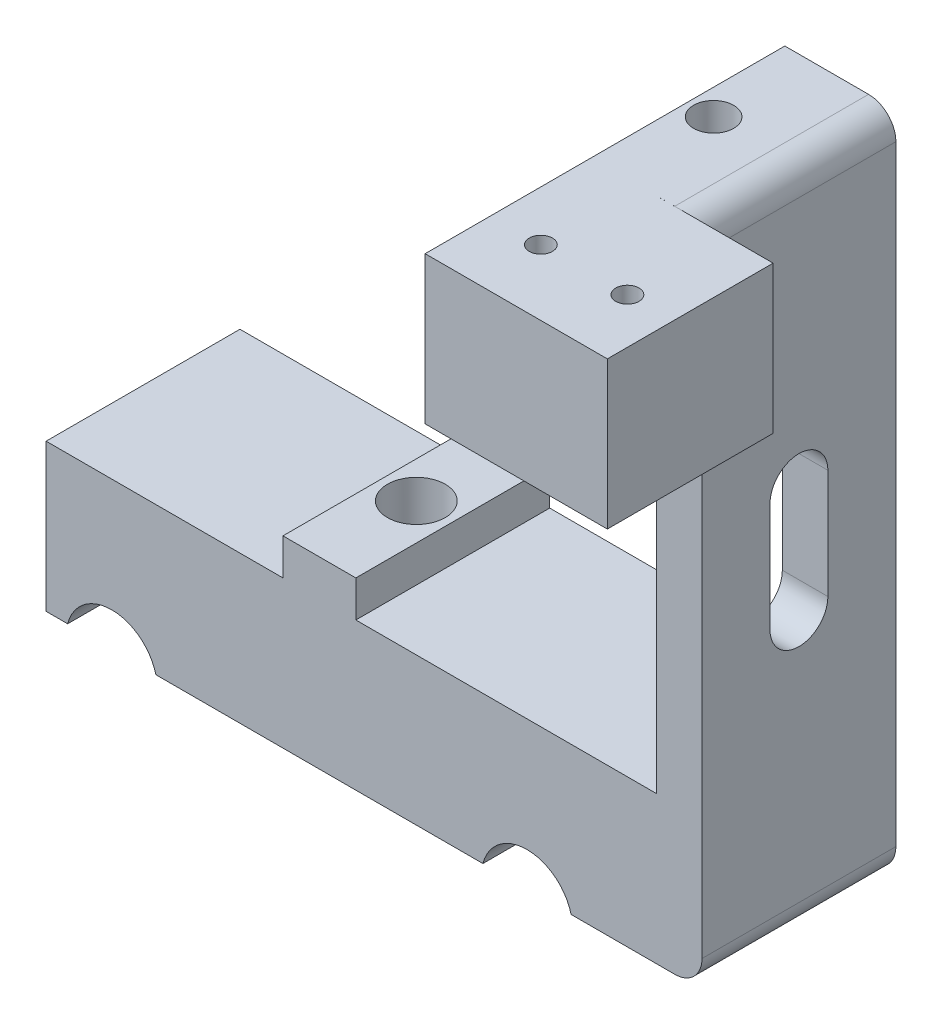
from build123d import *

# Parameters (mm, degrees)
BOSS_EXTRUDE1_DEPTH     = 10.8
BOSS_EXTRUDE2_DEPTH     = 10.64
CUT_EXTRUDE1_DEPTH      = 39.168054705
CUT_EXTRUDE1_DEPTH_BACK = 39.168054705
SKETCH5_R               = 5
FILLET1_R               = 1
SKETCH6_W               = 21.28
SKETCH6_H               = 16.18
BOSS_EXTRUDE3_DEPTH     = 12
SKETCH7_W               = 5
SKETCH7_H               = 21.281328743
BOSS_EXTRUDE4_DEPTH     = 56.83
SKETCH8_W               = 21.284331222
SKETCH8_H               = 16.18
BOSS_EXTRUDE5_DEPTH     = 7.19
FILLET3_R               = 3
SKETCH9_R               = 2.2
CUT_EXTRUDE2_DEPTH      = 85.918196519
SKETCH10_R              = 3.175
CUT_EXTRUDE3_DEPTH      = 85.918196519
SKETCH11_W              = 24.977296572
SKETCH11_H              = 9.721484234
CUT_EXTRUDE4_DEPTH      = 71.220021919
CUT_EXTRUDE5_DEPTH      = 90.46728118
SKETCH13_W              = 20
SKETCH13_H              = 16.18
BOSS_EXTRUDE6_DEPTH     = 18.2
SKETCH14_R              = 1.275
CUT_EXTRUDE6_DEPTH      = 93.969968226


with BuildPart() as part:
    # Sketch2 → Boss-Extrude1 (new body)
    with BuildSketch(Plane.XY):
        Polygon((10.1, 0), (10.1, 1.709943763), (6.25480432, 7), (-6.25480432, 7), (-10.1, 1.709943763), (-10.1, 0), align=None)
    extrude(amount=BOSS_EXTRUDE1_DEPTH)

    # Sketch4 → Boss-Extrude2 (add, symmetric)
    with BuildSketch(Plane.XY):
        Polygon((-4, 0), (-4, -4.8), (-30, -4.8), (-30, -20.98), (30, -20.98), (30, -4.8), (4, -4.8), (4, 0), align=None)
    extrude(amount=BOSS_EXTRUDE2_DEPTH, both=True)

    # Sketch5 → Cut-Extrude1 (cut, two sides: drawn at the far end of the back side and taken through both)
    with BuildSketch(Plane.XY.offset(-CUT_EXTRUDE1_DEPTH_BACK)):
        with Locations((-22.790976064, -22.227391232)):
            Circle(SKETCH5_R)
        with Locations((22.790976064, -22.227391232)):
            Circle(SKETCH5_R)
    extrude(amount=CUT_EXTRUDE1_DEPTH + CUT_EXTRUDE1_DEPTH_BACK, mode=Mode.SUBTRACT)

    # Fillet1
    fillet1_edges = [part.edges().sort_by_distance(p)[0] for p in [
        (-10.1, 0, 5.4),
        (-10.1, 1.709943763, 5.4),
        (-6.25480432, 7, 5.4),
        (6.25480432, 7, 5.4),
        (10.1, 0, 5.4),
        (10.1, 1.709943763, 5.4),
    ]]
    fillet(fillet1_edges, radius=FILLET1_R)

    # Sketch6 → Boss-Extrude3 (add)
    with BuildSketch(Plane(origin=(30, 0, 0), x_dir=(0, 0, -1), z_dir=(1, 0, 0))):
        with Locations((0, -12.89)):
            Rectangle(SKETCH6_W, SKETCH6_H)
    extrude(amount=BOSS_EXTRUDE3_DEPTH)

    # Sketch7 → Boss-Extrude4 (add)
    with BuildSketch(Plane(origin=(0, -4.8, 0), x_dir=(1, 0, 0), z_dir=(0, 1, 0))):
        with Locations((39.5, 0.000664372)):
            Rectangle(SKETCH7_W, SKETCH7_H)
    extrude(amount=BOSS_EXTRUDE4_DEPTH)

    # Sketch8 → Boss-Extrude5 (add)
    with BuildSketch(Plane.ZY.offset(-37)):
        with Locations((0.000836868, 43.94)):
            Rectangle(SKETCH8_W, SKETCH8_H)
    extrude(amount=BOSS_EXTRUDE5_DEPTH)

    # Fillet3
    fillet3_edges = [part.edges().sort_by_distance(p)[0] for p in [
        (42, 52.03, -0.000664372),
        (42, -20.98, 0),
    ]]
    fillet(fillet3_edges, radius=FILLET3_R)

    # Sketch9 → Cut-Extrude2 (cut, through all)
    with BuildSketch(Plane.XZ.offset(20.98)):
        with Locations((32.632878078, 0)):
            Circle(SKETCH9_R)
    extrude(amount=-CUT_EXTRUDE2_DEPTH, mode=Mode.SUBTRACT)

    # Sketch10 → Cut-Extrude3 (cut, through all)
    with BuildSketch(Plane.XZ.offset(20.98)):
        with Locations((0.000925951, 0)):
            Circle(SKETCH10_R)
    extrude(amount=-CUT_EXTRUDE3_DEPTH, mode=Mode.SUBTRACT)

    # Sketch11 → Cut-Extrude4 (cut, through all)
    with BuildSketch(Plane.XY.offset(10.8)):
        with Locations((-0.121132817, 4.060742117)):
            Rectangle(SKETCH11_W, SKETCH11_H)
    extrude(amount=-CUT_EXTRUDE4_DEPTH, mode=Mode.SUBTRACT)

    # Sketch12 → Cut-Extrude5 (cut, through all)
    with BuildSketch(Plane(origin=(42, 0, 0), x_dir=(0, 0, -1), z_dir=(1, 0, 0))):
        with BuildLine():
            Line((-3.175, 21.525), (-3.175, 9.525))
            ThreePointArc((-3.175, 9.525), (0, 6.35), (3.175, 9.525))
            Line((3.175, 9.525), (3.175, 21.525))
            ThreePointArc((3.175, 21.525), (0, 24.7), (-3.175, 21.525))
        make_face()
    extrude(amount=-CUT_EXTRUDE5_DEPTH, mode=Mode.SUBTRACT)

    # Sketch13 → Boss-Extrude6 (add)
    with BuildSketch(Plane.XY.offset(10.643002479)):
        with Locations((39.81, 43.94)):
            Rectangle(SKETCH13_W, SKETCH13_H)
    extrude(amount=BOSS_EXTRUDE6_DEPTH)

    # Sketch14 → Cut-Extrude6 (cut, through all)
    with BuildSketch(Plane(origin=(0, 52.03, 0), x_dir=(1, 0, 0), z_dir=(0, 1, 0))):
        with Locations((35.31, -21.643002479)):
            Circle(SKETCH14_R)
        with Locations((44.81, -21.643002479)):
            Circle(SKETCH14_R)
    extrude(amount=-CUT_EXTRUDE6_DEPTH, mode=Mode.SUBTRACT)


solid = part.part
